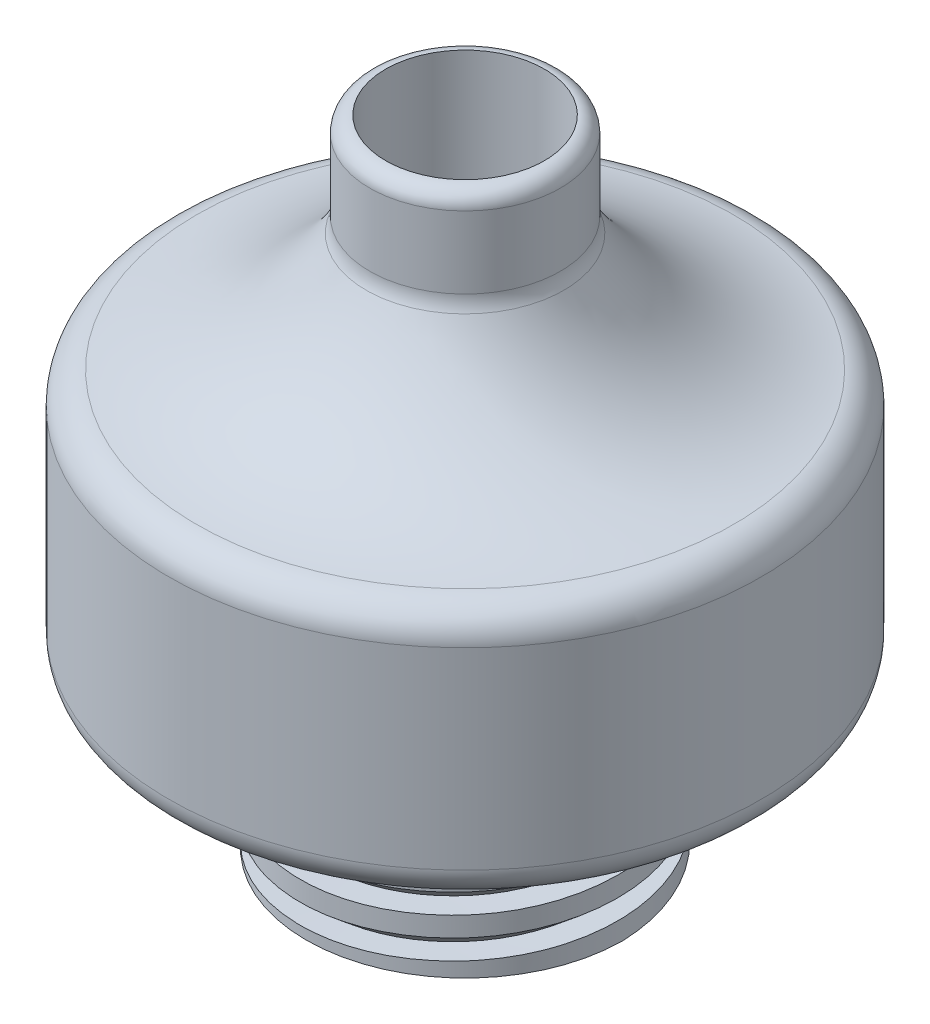
from build123d import *

# Parameters (mm, degrees)
KES_EKSTR_ZYON1_REACH = 25.956
IZIM2_R               = 2.5
KES_S_P_R1_PITCH      = 1.25
KES_S_P_R1_TO         = 5


with BuildPart() as part:
    # Çizim1 → Döndür1 (revolve)
    with BuildSketch(Plane.XY, mode=Mode.PRIVATE) as d_nd_r1_sk:
        with BuildLine():
            Line((0, -1.027887155), (5, -1.027887155))
            Line((5, -1.027887155), (5, 3.972112845))
            Line((5, 3.972112845), (8.32455532, 3.972112845))
            ThreePointArc((8.32455532, 3.972112845), (9.031662102, 4.265006064), (9.32455532, 4.972112845))
            Line((9.32455532, 4.972112845), (9.32455532, 11.034858912))
            ThreePointArc((9.32455532, 11.034858912), (9.07455532, 11.69629674), (8.44955532, 12.027015654))
            ThreePointArc((8.44955532, 12.027015654), (5.322926591, 13.228684643), (3.112574113, 15.745459861))
            ThreePointArc((3.112574113, 15.745459861), (3.028551111, 15.969161353), (3, 16.206410287))
            Line((3, 16.206410287), (3, 18.472112845))
            ThreePointArc((3, 18.472112845), (2.853553391, 18.825666236), (2.5, 18.972112845))
            Line((2.5, 18.972112845), (0, 18.972112845))
            Line((0, 18.972112845), (0, 15.972112845))
            Line((0, 15.972112845), (0, -1.027887155))
        make_face()
    revolve(d_nd_r1_sk.sketch.rotate(Axis((0, 15.972112845, 0), (0, -1, 0)), 180), axis=Axis((0, 15.972112845, 0), (0, -1, 0)))

    # Çizim2 → Kes-Ekstrüzyon1 (cut, up to next)
    with BuildSketch(Plane(origin=(0, 18.972112845, 0), x_dir=(1, 0, 0), z_dir=(0, 1, 0)), mode=Mode.PRIVATE) as kes_ekstr_zyon1_sk1:
        with Locations(Location((0, 0, 0), (0, 0, 180))):
            Circle(IZIM2_R)
    kes_ekstr_zyon1_tool1 = extrude(kes_ekstr_zyon1_sk1.sketch, amount=-KES_EKSTR_ZYON1_REACH, mode=Mode.PRIVATE) & part.part
    add(kes_ekstr_zyon1_tool1.solids().sort_by_distance((0, 18.972113, 0))[0], mode=Mode.SUBTRACT)

    # Kes-Süpür1: arcs per turn and ends read off the stored shape
    # Kes-Süpür1: the profile of Çizim7 screwed along a right-hand helix through 5.5 turns, 8 arcs to a turn; built about Z, then put on its axis
    kes_s_p_r1_z = Axis((0, 0, 0), (0, 0, 1))
    kes_s_p_r1_corners = [(4.250843742, 0, -1.25), (5.085388022, 0, -0.551697778), (5.085388022, 0, -1.25)]
    with BuildLine(mode=Mode.PRIVATE) as kes_s_p_r1_profile:
        Line(kes_s_p_r1_corners[0], kes_s_p_r1_corners[1])
        Line(kes_s_p_r1_corners[1], kes_s_p_r1_corners[2])
        Line(kes_s_p_r1_corners[2], kes_s_p_r1_corners[0])
    kes_s_p_r1_cap = Face(kes_s_p_r1_profile.wire())
    kes_s_p_r1_turn_angles = [0, 22.5, 45, 67.5, 90, 112.5, 135, 157.5, 180, 202.5, 225, 247.5, 270, 292.5, 315, 337.5, 360]
    kes_s_p_r1_turn_weights = [1, 0.9238795325112867, 1, 0.9238795325112867, 1, 0.9238795325112867, 1, 0.9238795325112867, 1, 0.9238795325112867, 1, 0.9238795325112867, 1, 0.9238795325112867, 1, 0.9238795325112867, 1]
    kes_s_p_r1_turn_rails = [Edge.make_bspline([Vector(p[0], p[1], 0).rotate(kes_s_p_r1_z, kes_s_p_r1_turn_angles[k]) / kes_s_p_r1_turn_weights[k] + Vector(0, 0, p[2] + KES_S_P_R1_PITCH * kes_s_p_r1_turn_angles[k] / 360) for k in range(17)], [0, 0, 0, 1, 1, 2, 2, 3, 3, 4, 4, 5, 5, 6, 6, 7, 7, 8, 8, 8], 2, kes_s_p_r1_turn_weights) for p in kes_s_p_r1_corners]
    kes_s_p_r1_turn_sides = [Face.make_surface_from_curves(kes_s_p_r1_turn_rails[p[0]], kes_s_p_r1_turn_rails[p[1]]) for p in [(0, 1), (1, 2), (2, 0)]]
    kes_s_p_r1_last_angles = [1800, 1822.5, 1845, 1867.5, 1890, 1912.5, 1935, 1957.5, 1980]
    kes_s_p_r1_last_weights = [1, 0.9238795325112867, 1, 0.9238795325112867, 1, 0.9238795325112867, 1, 0.9238795325112867, 1]
    kes_s_p_r1_last_rails = [Edge.make_bspline([Vector(p[0], p[1], 0).rotate(kes_s_p_r1_z, kes_s_p_r1_last_angles[k]) / kes_s_p_r1_last_weights[k] + Vector(0, 0, p[2] + KES_S_P_R1_PITCH * kes_s_p_r1_last_angles[k] / 360) for k in range(9)], [0, 0, 0, 1, 1, 2, 2, 3, 3, 4, 4, 4], 2, kes_s_p_r1_last_weights) for p in kes_s_p_r1_corners]
    kes_s_p_r1_last_sides = [Face.make_surface_from_curves(kes_s_p_r1_last_rails[p[0]], kes_s_p_r1_last_rails[p[1]]) for p in [(0, 1), (1, 2), (2, 0)]]
    kes_s_p_r1 = Plane(origin=(0, -1.027887155, 0), x_dir=(-1, 0, 0), z_dir=(0, 1, 0)) * split(Solid(Shell([*[p.moved(Location((0, 0, KES_S_P_R1_PITCH * i))) for i in range(5) for p in kes_s_p_r1_turn_sides], *kes_s_p_r1_last_sides, kes_s_p_r1_cap, kes_s_p_r1_cap.rotate(kes_s_p_r1_z, 1980).moved(Location((0, 0, KES_S_P_R1_PITCH * 1980 / 360)))])), bisect_by=Plane.XY.offset(KES_S_P_R1_TO), keep=Keep.BOTTOM, mode=Mode.PRIVATE)
    add(kes_s_p_r1, mode=Mode.SUBTRACT)


solid = part.part
